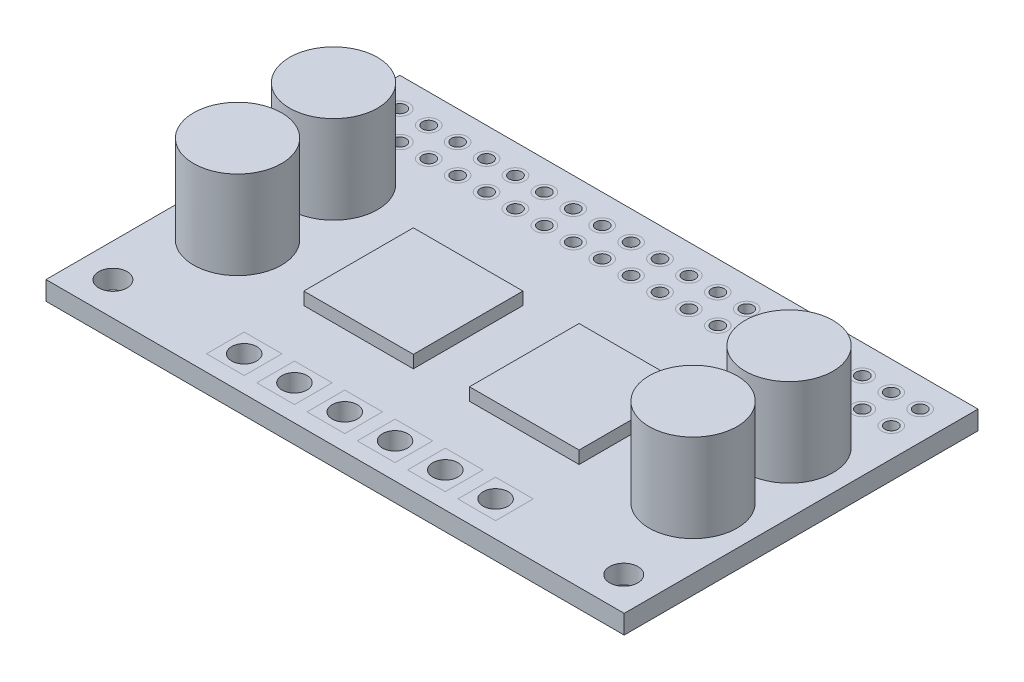
from build123d import *

# Parameters (mm, degrees)
SKETCH1_W               = 46
SKETCH1_H               = 28.15
SKETCH1_R               = 1.125
BOSS_EXTRUDE1_DEPTH     = 1.5
SKETCH3_R               = 3.5
BOSS_EXTRUDE3_DEPTH     = 7
SKETCH4_W               = 8.717739144
SKETCH4_H               = 8.717739144
BOSS_EXTRUDE4_DEPTH     = 1
CUT_EXTRUDE1_DEPTH      = 28.858672348
CUT_EXTRUDE1_DEPTH_BACK = 28.858672348
SKETCH5_R               = 0.5
SKETCH6_R               = 1
CUT_EXTRUDE2_DEPTH      = 28.858672348


with BuildPart() as part:
    # Sketch1 → Boss-Extrude1 (new body)
    with BuildSketch(Plane(origin=(0, 0, 0), x_dir=(1, 0, 0), z_dir=(0, 1, 0))):
        Rectangle(SKETCH1_W, SKETCH1_H)
        with Locations((20.32, -11.43)):
            Circle(SKETCH1_R, mode=Mode.SUBTRACT)
        with Locations((-20.32, -11.43)):
            Circle(SKETCH1_R, mode=Mode.SUBTRACT)
    extrude(amount=BOSS_EXTRUDE1_DEPTH)

    # Sketch3 → Boss-Extrude3 (add)
    with BuildSketch(Plane(origin=(0, 1.5, 0), x_dir=(1, 0, 0), z_dir=(0, 1, 0))):
        with Locations((-18.121197368, 3.9224412)):
            Circle(SKETCH3_R)
        with Locations((-18.121197368, -3.713656139)):
            Circle(SKETCH3_R)
        with Locations((18.121197368, -3.713656139)):
            Circle(SKETCH3_R)
        with Locations((18.121197368, 3.9224412)):
            Circle(SKETCH3_R)
    extrude(amount=BOSS_EXTRUDE3_DEPTH)

    # Sketch4 → Boss-Extrude4 (add)
    with BuildSketch(Plane(origin=(0, 1.5, 0), x_dir=(1, 0, 0), z_dir=(0, 1, 0))):
        with Locations((-6.593331203, -1.256115167)):
            Rectangle(SKETCH4_W, SKETCH4_H)
        with Locations((6.593331203, -1.256115167)):
            Rectangle(SKETCH4_W, SKETCH4_H)
    extrude(amount=BOSS_EXTRUDE4_DEPTH)

    # Sketch5 → Cut-Extrude1 (cut, two sides: drawn at the far end of the back side and taken through both)
    with BuildSketch(Plane(origin=(0, 1.5, 0), x_dir=(1, 0, 0), z_dir=(0, 1, 0)).offset(-CUT_EXTRUDE1_DEPTH_BACK)):
        with Locations((-20.7, 11.775)):
            Circle(SKETCH5_R)
        with Locations((-18.4, 11.775)):
            Circle(SKETCH5_R)
        with Locations((-16.1, 11.775)):
            Circle(SKETCH5_R)
        with Locations((-13.8, 11.775)):
            Circle(SKETCH5_R)
        with Locations((-11.5, 11.775)):
            Circle(SKETCH5_R)
        with Locations((-9.2, 11.775)):
            Circle(SKETCH5_R)
        with Locations((-6.9, 11.775)):
            Circle(SKETCH5_R)
        with Locations((-4.6, 11.775)):
            Circle(SKETCH5_R)
        with Locations((-2.3, 11.775)):
            Circle(SKETCH5_R)
        with Locations((0, 11.775)):
            Circle(SKETCH5_R)
        with Locations((2.3, 11.775)):
            Circle(SKETCH5_R)
        with Locations((4.6, 11.775)):
            Circle(SKETCH5_R)
        with Locations((6.9, 11.775)):
            Circle(SKETCH5_R)
        with Locations((9.2, 11.775)):
            Circle(SKETCH5_R)
        with Locations((11.5, 11.775)):
            Circle(SKETCH5_R)
        with Locations((13.8, 11.775)):
            Circle(SKETCH5_R)
        with Locations((16.1, 11.775)):
            Circle(SKETCH5_R)
        with Locations((18.4, 11.775)):
            Circle(SKETCH5_R)
        with Locations((20.7, 11.775)):
            Circle(SKETCH5_R)
        with Locations((-18.4, 9.475)):
            Circle(SKETCH5_R)
        with Locations((-16.1, 9.475)):
            Circle(SKETCH5_R)
        with Locations((-13.8, 9.475)):
            Circle(SKETCH5_R)
        with Locations((-11.5, 9.475)):
            Circle(SKETCH5_R)
        with Locations((-9.2, 9.475)):
            Circle(SKETCH5_R)
        with Locations((-6.9, 9.475)):
            Circle(SKETCH5_R)
        with Locations((-4.6, 9.475)):
            Circle(SKETCH5_R)
        with Locations((-2.3, 9.475)):
            Circle(SKETCH5_R)
        with Locations((0, 9.475)):
            Circle(SKETCH5_R)
        with Locations((2.3, 9.475)):
            Circle(SKETCH5_R)
        with Locations((4.6, 9.475)):
            Circle(SKETCH5_R)
        with Locations((6.9, 9.475)):
            Circle(SKETCH5_R)
        with Locations((9.2, 9.475)):
            Circle(SKETCH5_R)
        with Locations((11.5, 9.475)):
            Circle(SKETCH5_R)
        with Locations((13.8, 9.475)):
            Circle(SKETCH5_R)
        with Locations((16.1, 9.475)):
            Circle(SKETCH5_R)
        with Locations((18.4, 9.475)):
            Circle(SKETCH5_R)
        with Locations((20.7, 9.475)):
            Circle(SKETCH5_R)
        with Locations((-20.7, 9.475)):
            Circle(SKETCH5_R)
    extrude(amount=CUT_EXTRUDE1_DEPTH + CUT_EXTRUDE1_DEPTH_BACK, mode=Mode.SUBTRACT)

    # Sketch6 → Cut-Extrude2 (cut, through all)
    with BuildSketch(Plane(origin=(0, 1.5, 0), x_dir=(1, 0, 0), z_dir=(0, 1, 0))):
        with Locations((-10, -11.306210098)):
            Circle(SKETCH6_R)
        with Locations((-6, -11.306210098)):
            Circle(SKETCH6_R)
        with Locations((-2, -11.306210098)):
            Circle(SKETCH6_R)
        with Locations((2, -11.306210098)):
            Circle(SKETCH6_R)
        with Locations((6, -11.306210098)):
            Circle(SKETCH6_R)
        with Locations((10, -11.306210098)):
            Circle(SKETCH6_R)
    extrude(amount=-CUT_EXTRUDE2_DEPTH, mode=Mode.SUBTRACT)


solid = part.part
